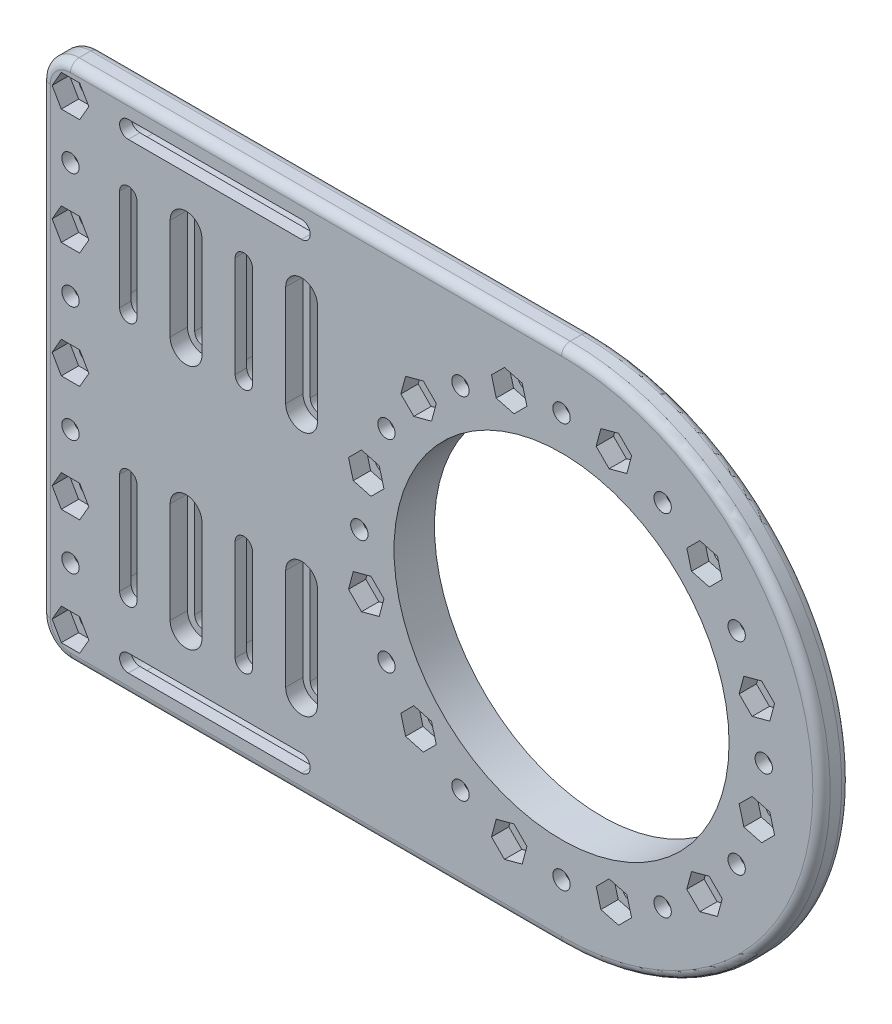
from build123d import *

# Parameters (mm, degrees)
EXTRUDE_1_DEPTH             = 5
SKETCH_2_R                  = 29
CUT_EXTRUDE_1_DEPTH         = 101.747208398
SKETCH_3_R                  = 45
SKETCH_3_R_2                = 29
EXTRUDE_2_DEPTH             = 2
SKETCH_9_R                  = 45
SKETCH_9_R_2                = 31
CUT_EXTRUDE_10_DEPTH        = 2
SKETCH_5_R                  = 1.5
CUT_EXTRUDE_2_DEPTH         = 101.747208398
CUT_EXTRUDE_3_DEPTH         = 3
SKETCH_10_R                 = 1.5
CUT_EXTRUDE_11_DEPTH        = 101.866248071
CUT_EXTRUDE_12_DEPTH        = 3
PATTERN_CIRCULAR_1_COUNT    = 12
CUT_EXTRUDE_7_DEPTH         = 101.866248071
CUT_EXTRUDE_9_DEPTH         = 3
SKETCH_12_R                 = 1.5
CUT_EXTRUDE_13_DEPTH        = 101.866248071
CUT_EXTRUDE_14_DEPTH        = 3
PATTERN_LINEAR_5_COUNT      = 5
PATTERN_LINEAR_5_PITCH      = 10
PATTERN_LINEAR_5_COL_COUNT  = 5
PATTERN_LINEAR_5_COL_PITCH  = 10
PATTERN_LINEAR_1_COUNT      = 3
PATTERN_LINEAR_1_PITCH      = 20
PATTERN_LINEAR_1_COL_COUNT  = 3
PATTERN_LINEAR_1_COL_PITCH  = 20
CUT_EXTRUDE_18_DEPTH        = 3
PATTERN_LINEAR_6_COUNT      = 3
PATTERN_LINEAR_6_PITCH      = 20
PATTERN_LINEAR_6_COUNT_DIR2 = 3
PATTERN_LINEAR_6_PITCH_DIR2 = 20
CUT_EXTRUDE_15_DEPTH        = 101.866248071
CUT_EXTRUDE_16_DEPTH        = 3
PATTERN_LINEAR_2_COUNT      = 4
PATTERN_LINEAR_2_PITCH      = 10
PATTERN_LINEAR_3_COUNT      = 2
PATTERN_LINEAR_3_PITCH      = 20
CUT_EXTRUDE_17_DEPTH        = 3
PATTERN_LINEAR_4_COUNT      = 2
PATTERN_LINEAR_4_PITCH      = 20
FILLET_4_R                  = 1.5
FILLET_5_R                  = 5


with BuildPart() as part:
    # 草图1 → 凸台-拉伸1 (new body)
    with BuildSketch(Plane.XY):
        with BuildLine():
            Line((-45, -45), (45, -45))
            ThreePointArc((45, -45), (90, 0), (45, 45))
            Line((45, 45), (-45, 45))
            Line((-45, 45), (-45, -45))
        make_face()
    extrude(amount=EXTRUDE_1_DEPTH)

    # 草图2 → 切除-拉伸1 (cut, through all)
    with BuildSketch(Plane.XY.offset(5)):
        with Locations((45, 0)):
            Circle(SKETCH_2_R)
    cut_extrude_1 = extrude(amount=-CUT_EXTRUDE_1_DEPTH, mode=Mode.SUBTRACT)

    # 草图3 → 凸台-拉伸2 (add)
    with BuildSketch(Plane.XY):
        with Locations(Location((45, 0, 0), (0, 0, 270))):
            Circle(SKETCH_3_R)
        with Locations((45, 0)):
            Circle(SKETCH_3_R_2, mode=Mode.SUBTRACT)
    extrude(amount=-EXTRUDE_2_DEPTH)

    # 草图9 → 切除-拉伸10 (cut)
    with BuildSketch(Plane(origin=(0, 0, -2), x_dir=(-1, 0, 0), z_dir=(0, 0, -1))):
        with Locations((-45, 0)):
            Circle(SKETCH_9_R)
        with Locations((-45, 0)):
            Circle(SKETCH_9_R_2, mode=Mode.SUBTRACT)
    extrude(amount=-CUT_EXTRUDE_10_DEPTH, mode=Mode.SUBTRACT)

    # 草图5 → 切除-拉伸2 (cut, through all)
    with BuildSketch(Plane(origin=(0, 0, 0), x_dir=(-1, 0, 0), z_dir=(0, 0, -1))):
        with Locations((-45, 35)):
            Circle(SKETCH_5_R)
    cut_extrude_2 = extrude(amount=-CUT_EXTRUDE_2_DEPTH, mode=Mode.SUBTRACT)

    # 草图6 → 切除-拉伸3 (cut)
    with BuildSketch(Plane(origin=(0, 0, 0), x_dir=(-1, 0, 0), z_dir=(0, 0, -1))):
        Polygon((-45, 31.824573519), (-42.25, 33.41228676), (-42.25, 36.58771324), (-45, 38.175426481), (-47.75, 36.58771324), (-47.75, 33.41228676), align=None)
    cut_extrude_3 = extrude(amount=-CUT_EXTRUDE_3_DEPTH, mode=Mode.SUBTRACT)

    # 草图10 → 切除-拉伸11 (cut, through all)
    with BuildSketch(Plane(origin=(0, 0, -2), x_dir=(-1, 0, 0), z_dir=(0, 0, -1))):
        with Locations((-35.941333421, 33.80740392)):
            Circle(SKETCH_10_R)
    cut_extrude_11 = extrude(amount=-CUT_EXTRUDE_11_DEPTH, mode=Mode.SUBTRACT)

    # 草图11 → 切除-拉伸12 (cut)
    with BuildSketch(Plane.XY.offset(5)):
        Polygon((36.763194271, 30.740177473), (39.008559868, 32.985543071), (38.186699019, 36.052769518), (35.119472572, 36.874630367), (32.874106974, 34.62926477), (33.695967824, 31.562038323), align=None)
    cut_extrude_12 = extrude(amount=-CUT_EXTRUDE_12_DEPTH, mode=Mode.SUBTRACT)

    # 阵列(圆周)1: 切除-拉伸1, 切除-拉伸2, 切除-拉伸3, 切除-拉伸11, 切除-拉伸12 ×12 about axis
    pattern_circular_1_axis = Axis((45, 0, 0), (0, 0, 1))
    add([cut_extrude_1.rotate(pattern_circular_1_axis, i * 360 / PATTERN_CIRCULAR_1_COUNT) for i in range(1, PATTERN_CIRCULAR_1_COUNT)], mode=Mode.SUBTRACT)
    add([cut_extrude_2.rotate(pattern_circular_1_axis, i * 360 / PATTERN_CIRCULAR_1_COUNT) for i in range(1, PATTERN_CIRCULAR_1_COUNT)], mode=Mode.SUBTRACT)
    add([cut_extrude_3.rotate(pattern_circular_1_axis, i * 360 / PATTERN_CIRCULAR_1_COUNT) for i in range(1, PATTERN_CIRCULAR_1_COUNT)], mode=Mode.SUBTRACT)
    add([cut_extrude_11.rotate(pattern_circular_1_axis, i * 360 / PATTERN_CIRCULAR_1_COUNT) for i in range(1, PATTERN_CIRCULAR_1_COUNT)], mode=Mode.SUBTRACT)
    add([cut_extrude_12.rotate(pattern_circular_1_axis, i * 360 / PATTERN_CIRCULAR_1_COUNT) for i in range(1, PATTERN_CIRCULAR_1_COUNT)], mode=Mode.SUBTRACT)

    # 草图7 → 切除-拉伸7 (cut, through all)
    with BuildSketch(Plane.XY.offset(5)):
        with BuildLine():
            Line((-30, 41.5), (0, 41.5))
            ThreePointArc((0, 41.5), (1.5, 40), (0, 38.5))
            Line((0, 38.5), (-30, 38.5))
            ThreePointArc((-30, 38.5), (-31.5, 40), (-30, 41.5))
        make_face()
        with BuildLine():
            Line((-30, -41.5), (0, -41.5))
            ThreePointArc((0, -41.5), (1.5, -40), (0, -38.5))
            Line((0, -38.5), (-30, -38.5))
            ThreePointArc((-30, -38.5), (-31.5, -40), (-30, -41.5))
        make_face()
    extrude(amount=-CUT_EXTRUDE_7_DEPTH, mode=Mode.SUBTRACT)

    # 草图8 → 切除-拉伸9 (cut)
    with BuildSketch(Plane.XY):
        with BuildLine():
            Line((-30, 42.75), (0, 42.75))
            ThreePointArc((0, 42.75), (2.75, 40), (0, 37.25))
            Line((0, 37.25), (-30, 37.25))
            ThreePointArc((-30, 37.25), (-32.75, 40), (-30, 42.75))
        make_face()
        with BuildLine():
            Line((-30, -37.25), (0, -37.25))
            ThreePointArc((0, -37.25), (2.75, -40), (0, -42.75))
            Line((0, -42.75), (-30, -42.75))
            ThreePointArc((-30, -42.75), (-32.75, -40), (-30, -37.25))
        make_face()
    extrude(amount=CUT_EXTRUDE_9_DEPTH, mode=Mode.SUBTRACT)

    # 草图12 → 切除-拉伸13 (cut, through all)
    with BuildSketch(Plane.XY.offset(5)):
        with Locations((-40, 0)):
            Circle(SKETCH_12_R)
    cut_extrude_13 = extrude(amount=-CUT_EXTRUDE_13_DEPTH, mode=Mode.SUBTRACT)

    # 草图13 → 切除-拉伸14 (cut)
    with BuildSketch(Plane.XY.offset(5)):
        Polygon((-36.824573519, 0), (-38.41228676, 2.75), (-41.58771324, 2.75), (-43.175426481, 0), (-41.58771324, -2.75), (-38.41228676, -2.75), align=None)
    cut_extrude_14 = extrude(amount=-CUT_EXTRUDE_14_DEPTH, mode=Mode.SUBTRACT)

    # 阵列(线性)5: 切除-拉伸13 ×5
    with Locations(*[(0, -i * PATTERN_LINEAR_5_PITCH, 0) for i in range(1, PATTERN_LINEAR_5_COUNT)]):
        add(cut_extrude_13, mode=Mode.SUBTRACT)

    # 阵列(线性)5 col: 切除-拉伸13 ×5
    with Locations(*[(0, i * PATTERN_LINEAR_5_COL_PITCH, 0) for i in range(1, PATTERN_LINEAR_5_COL_COUNT)]):
        add(cut_extrude_13, mode=Mode.SUBTRACT)

    # 阵列(线性)1: 切除-拉伸14 ×3
    with Locations(*[(0, -i * PATTERN_LINEAR_1_PITCH, 0) for i in range(1, PATTERN_LINEAR_1_COUNT)]):
        add(cut_extrude_14, mode=Mode.SUBTRACT)

    # 阵列(线性)1 col: 切除-拉伸14 ×3
    with Locations(*[(0, i * PATTERN_LINEAR_1_COL_PITCH, 0) for i in range(1, PATTERN_LINEAR_1_COL_COUNT)]):
        add(cut_extrude_14, mode=Mode.SUBTRACT)

    # 草图17 → 切除-拉伸18 (cut)
    with BuildSketch(Plane(origin=(0, 0, 0), x_dir=(-1, 0, 0), z_dir=(0, 0, -1))):
        Polygon((43.175426481, 10), (41.58771324, 12.75), (38.41228676, 12.75), (36.824573519, 10), (38.41228676, 7.25), (41.58771324, 7.25), align=None)
    cut_extrude_18 = extrude(amount=-CUT_EXTRUDE_18_DEPTH, mode=Mode.SUBTRACT)

    # 阵列(线性)6: Cut-Extrude 18 3 × 3
    with Locations(*[Vector(0, -1, 0) * (i * PATTERN_LINEAR_6_PITCH) + Vector(0, 1, 0) * (j * PATTERN_LINEAR_6_PITCH_DIR2) for i in range(PATTERN_LINEAR_6_COUNT) for j in range(PATTERN_LINEAR_6_COUNT_DIR2) if (i, j) != (0, 0)]):
        add(cut_extrude_18, mode=Mode.SUBTRACT)

    # 草图14 → 切除-拉伸15 (cut, through all)
    with BuildSketch(Plane.XY.offset(5)):
        with BuildLine():
            Line((1.5, 30), (1.5, 12.5))
            ThreePointArc((1.5, 12.5), (0, 11), (-1.5, 12.5))
            Line((-1.5, 12.5), (-1.5, 30))
            ThreePointArc((-1.5, 30), (0, 31.5), (1.5, 30))
        make_face()
        with BuildLine():
            Line((1.5, -30), (1.5, -12.5))
            ThreePointArc((1.5, -12.5), (0, -11), (-1.5, -12.5))
            Line((-1.5, -12.5), (-1.5, -30))
            ThreePointArc((-1.5, -30), (0, -31.5), (1.5, -30))
        make_face()
    cut_extrude_15 = extrude(amount=-CUT_EXTRUDE_15_DEPTH, mode=Mode.SUBTRACT)

    # 草图15 → 切除-拉伸16 (cut)
    with BuildSketch(Plane.XY.offset(5)):
        with BuildLine():
            Line((-2.75, 12.5), (-2.75, 30))
            ThreePointArc((-2.75, 30), (0, 32.75), (2.75, 30))
            Line((2.75, 30), (2.75, 12.5))
            ThreePointArc((2.75, 12.5), (0, 9.75), (-2.75, 12.5))
        make_face()
        with BuildLine():
            Line((2.75, -12.5), (2.75, -30))
            ThreePointArc((2.75, -30), (0, -32.75), (-2.75, -30))
            Line((-2.75, -30), (-2.75, -12.5))
            ThreePointArc((-2.75, -12.5), (0, -9.75), (2.75, -12.5))
        make_face()
    cut_extrude_16 = extrude(amount=-CUT_EXTRUDE_16_DEPTH, mode=Mode.SUBTRACT)

    # 阵列(线性)2: 切除-拉伸15 ×4
    with Locations(*[(-i * PATTERN_LINEAR_2_PITCH, 0, 0) for i in range(1, PATTERN_LINEAR_2_COUNT)]):
        add(cut_extrude_15, mode=Mode.SUBTRACT)

    # 阵列(线性)3: 切除-拉伸16 ×2
    with Locations(*[(-i * PATTERN_LINEAR_3_PITCH, 0, 0) for i in range(1, PATTERN_LINEAR_3_COUNT)]):
        add(cut_extrude_16, mode=Mode.SUBTRACT)

    # 草图16 → 切除-拉伸17 (cut)
    with BuildSketch(Plane(origin=(0, 0, 0), x_dir=(-1, 0, 0), z_dir=(0, 0, -1))):
        with BuildLine():
            Line((32.75, 30), (32.75, 12.5))
            ThreePointArc((32.75, 12.5), (30, 9.75), (27.25, 12.5))
            Line((27.25, 12.5), (27.25, 30))
            ThreePointArc((27.25, 30), (30, 32.75), (32.75, 30))
        make_face()
        with BuildLine():
            Line((32.75, -12.5), (32.75, -30))
            ThreePointArc((32.75, -30), (30, -32.75), (27.25, -30))
            Line((27.25, -30), (27.25, -12.5))
            ThreePointArc((27.25, -12.5), (30, -9.75), (32.75, -12.5))
        make_face()
    cut_extrude_17 = extrude(amount=-CUT_EXTRUDE_17_DEPTH, mode=Mode.SUBTRACT)

    # 阵列(线性)4: 切除-拉伸17 ×2
    with Locations(*[(i * PATTERN_LINEAR_4_PITCH, 0, 0) for i in range(1, PATTERN_LINEAR_4_COUNT)]):
        add(cut_extrude_17, mode=Mode.SUBTRACT)

    # 圆角4
    fillet_4_edges = [part.edges().sort_by_distance(p)[0] for p in [
        (-45, 0, 5),
        (0, -45, 5),
        (90, 0, 0),
        (90, 0, 5),
        (0, -45, 0),
        (-45, 0, 0),
        (0, 45, 0),
        (0, 45, 5),
    ]]
    fillet(fillet_4_edges, radius=FILLET_4_R)

    # 圆角5
    # the kernel refuses this fillet: 5 mm, written as the material it takes off along each edge
    with BuildSketch(Plane(origin=(-40, -40, 5), x_dir=(-1, 0, 0), z_dir=(0, 1, 0))) as fillet_5_piece_1:
        with BuildLine():
            CenterArc((3.5, -1.5), 1.5, 0, 90)
            Line((5, -1.5), (5, 0))
            Line((5, 0), (3.5, 0))
        make_face()
    revolve(axis=Axis((-40, -40, 5), (0, 0, 1)), revolution_arc=90, mode=Mode.SUBTRACT)
    with BuildSketch(Plane(origin=(-40, 40, 5), x_dir=(0, 1, 0), z_dir=(1, 0, 0))) as fillet_5_piece_2:
        with BuildLine():
            CenterArc((3.5, -1.5), 1.5, 0, 90)
            Line((5, -1.5), (5, 0))
            Line((5, 0), (3.5, 0))
        make_face()
    revolve(axis=Axis((-40, 40, 5), (0, 0, 1)), revolution_arc=90, mode=Mode.SUBTRACT)
    with BuildSketch(Plane(origin=(-40, 40, 0), x_dir=(-1, 0, 0), z_dir=(0, -1, 0))) as fillet_5_piece_3:
        with BuildLine():
            CenterArc((3.5, -1.5), 1.5, 0, 90)
            Line((5, -1.5), (5, 0))
            Line((5, 0), (3.5, 0))
        make_face()
    revolve(axis=Axis((-40, 40, 0), (0, 0, -1)), revolution_arc=90, mode=Mode.SUBTRACT)
    with BuildSketch(Plane(origin=(-40, -40, 0), x_dir=(0, -1, 0), z_dir=(1, 0, 0))) as fillet_5_piece_4:
        with BuildLine():
            CenterArc((3.5, -1.5), 1.5, 0, 90)
            Line((5, -1.5), (5, 0))
            Line((5, 0), (3.5, 0))
        make_face()
    revolve(axis=Axis((-40, -40, 0), (0, 0, -1)), revolution_arc=90, mode=Mode.SUBTRACT)
    with BuildSketch(Plane(origin=(-45, 45, 0), x_dir=(1, 0, 0), z_dir=(0, 0, 1)), Plane(origin=(-45, -45, 0), x_dir=(0, 1, 0), z_dir=(0, 0, 1))) as fillet_5_piece_5:
        with BuildLine():
            CenterArc((FILLET_5_R, -FILLET_5_R), FILLET_5_R, 90, 90)
            Line((0, -FILLET_5_R), (0, 0))
            Line((0, 0), (FILLET_5_R, 0))
        make_face()
    extrude(amount=5, mode=Mode.SUBTRACT)


solid = part.part
